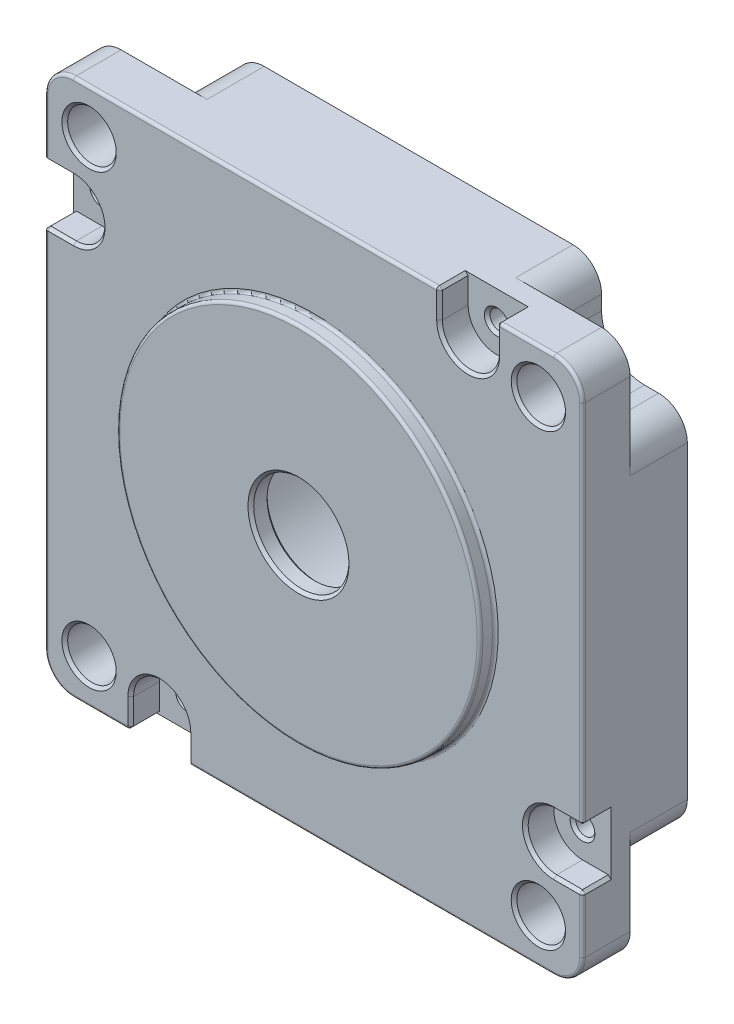
from build123d import *

# Parameters (mm, degrees)
SKETCH1_R           = 5
SKETCH1_R_2         = 2.55
SKETCH1_R_3         = 1
BOSS_EXTRUDE1_DEPTH = 11
SKETCH2_R           = 19.05
SKETCH2_R_2         = 5
BOSS_EXTRUDE2_DEPTH = 1.6
CUT_EXTRUDE1_DEPTH  = 3
FILLET1_R           = 0.3
CHAMFER1_SIZE       = 0.3
CUT_EXTRUDE2_DEPTH  = 6
CHAMFER2_SIZE       = 0.3
CUT_EXTRUDE3_DEPTH  = 8
SKETCH6_R           = 9
SKETCH6_R_2         = 5
CUT_EXTRUDE4_DEPTH  = 2.6
SKETCH7_R           = 11
SKETCH7_R_2         = 9
CUT_EXTRUDE5_DEPTH  = 1.6
BOSS_EXTRUDE3_START = 3
SKETCH8_R           = 17.5
SKETCH8_R_2         = 11
BOSS_EXTRUDE3_DEPTH = 3
BOSS_EXTRUDE4_START = 7
SKETCH9_R           = 17
SKETCH9_R_2         = 11
BOSS_EXTRUDE4_DEPTH = 7
CHAMFER3_SIZE       = 0.3
CHAMFER4_SIZE       = 0.5
CHAMFER5_SIZE       = 1
CHAMFER5_SIZE2      = 1.732050808


with BuildPart() as part:
    # Sketch1 → Boss-Extrude1 (new body)
    with BuildSketch(Plane.XY):
        with BuildLine():
            Line((-25.2, 28.2), (25.2, 28.2))
            ThreePointArc((25.2, 28.2), (27.321320344, 27.321320344), (28.2, 25.2))
            Line((28.2, 25.2), (28.2, -25.2))
            ThreePointArc((28.2, -25.2), (27.321320344, -27.321320344), (25.2, -28.2))
            Line((25.2, -28.2), (-25.2, -28.2))
            ThreePointArc((-25.2, -28.2), (-27.321320344, -27.321320344), (-28.2, -25.2))
            Line((-28.2, -25.2), (-28.2, 25.2))
            ThreePointArc((-28.2, 25.2), (-27.321320344, 27.321320344), (-25.2, 28.2))
        make_face()
        Circle(SKETCH1_R, mode=Mode.SUBTRACT)
        with Locations((-23.57, 23.57)):
            Circle(SKETCH1_R_2, mode=Mode.SUBTRACT)
        with Locations(Location((23.57, 23.57, 0), (0, 0, 180))):
            Circle(SKETCH1_R_2, mode=Mode.SUBTRACT)
        with Locations((23.57, -23.57)):
            Circle(SKETCH1_R_2, mode=Mode.SUBTRACT)
        with Locations(Location((-23.57, -23.57, 0), (0, 0, 180))):
            Circle(SKETCH1_R_2, mode=Mode.SUBTRACT)
        with Locations((16.2, 25.2)):
            Circle(SKETCH1_R_3, mode=Mode.SUBTRACT)
        with Locations((-25.2, 16.2)):
            Circle(SKETCH1_R_3, mode=Mode.SUBTRACT)
        with Locations((-16.2, -25.2)):
            Circle(SKETCH1_R_3, mode=Mode.SUBTRACT)
        with Locations((25.2, -16.2)):
            Circle(SKETCH1_R_3, mode=Mode.SUBTRACT)
    extrude(amount=BOSS_EXTRUDE1_DEPTH)

    # Sketch2 → Boss-Extrude2 (add)
    with BuildSketch(Plane.XY.offset(11)):
        with Locations(Location((0, 0, 0), (0, 0, 180))):
            Circle(SKETCH2_R)
        Circle(SKETCH2_R_2, mode=Mode.SUBTRACT)
    extrude(amount=BOSS_EXTRUDE2_DEPTH)

    # Sketch3 → Cut-Extrude1 (cut)
    with BuildSketch(Plane.XY.offset(11)):
        with BuildLine():
            Line((13.2, 28.2), (19.2, 28.2))
            Line((19.2, 28.2), (19.2, 25.2))
            ThreePointArc((19.2, 25.2), (16.2, 22.2), (13.2, 25.2))
            Line((13.2, 25.2), (13.2, 28.2))
        make_face()
        with BuildLine():
            Line((-28.2, 13.2), (-28.2, 19.2))
            Line((-28.2, 19.2), (-25.2, 19.2))
            ThreePointArc((-25.2, 19.2), (-22.2, 16.2), (-25.2, 13.2))
            Line((-25.2, 13.2), (-28.2, 13.2))
        make_face()
        with BuildLine():
            Line((28.2, -13.2), (28.2, -19.2))
            Line((28.2, -19.2), (25.2, -19.2))
            ThreePointArc((25.2, -19.2), (22.2, -16.2), (25.2, -13.2))
            Line((25.2, -13.2), (28.2, -13.2))
        make_face()
        with BuildLine():
            Line((-13.2, -28.2), (-13.2, -25.2))
            ThreePointArc((-13.2, -25.2), (-16.2, -22.2), (-19.2, -25.2))
            Line((-19.2, -25.2), (-19.2, -28.2))
            Line((-19.2, -28.2), (-13.2, -28.2))
        make_face()
    extrude(amount=-CUT_EXTRUDE1_DEPTH, mode=Mode.SUBTRACT)

    # Fillet1
    fillet1_edges = [part.edges().sort_by_distance(p)[0] for p in [
        (-27.321320344, 27.321320344, 11),
        (6, -28.2, 11),
        (-28.2, 22.2, 11),
        (-27.321320344, -27.321320344, 11),
        (-22.2, -28.2, 11),
        (27.321320344, -27.321320344, 11),
        (28.2, -22.2, 11),
        (27.321320344, 27.321320344, 11),
        (19.05, 0, 11),
        (19.05, 0, 12.6),
        (22.2, 28.2, 11),
        (-6, 28.2, 11),
        (-28.2, -6, 11),
        (28.2, 6, 11),
    ]]
    fillet(fillet1_edges, radius=FILLET1_R)

    # Chamfer1
    chamfer1_edges = [part.edges().sort_by_distance(p)[0] for p in [
        (28.2, -13.2, 9.35),
        (28.2, -19.2, 9.35),
        (24.2, -16.2, 8),
        (22.2, -16.2, 11),
        (26.55, -19.2, 11),
        (-13.2, -28.2, 9.35),
        (-19.2, -28.2, 9.35),
        (-17.2, -25.2, 8),
        (-16.2, -22.2, 11),
        (-19.2, -26.55, 11),
        (-13.2, -26.55, 11),
        (26.55, -13.2, 11),
        (13.2, 26.55, 11),
        (-26.55, 13.2, 11),
        (-28.112132034, 19.2, 10.912132034),
        (19.2, 28.112132034, 10.912132034),
        (28.112132034, -19.2, 10.912132034),
        (-19.2, -28.112132034, 10.912132034),
        (13.2, 28.112132034, 10.912132034),
        (28.112132034, -13.2, 10.912132034),
        (-13.2, -28.112132034, 10.912132034),
        (-28.112132034, 13.2, 10.912132034),
        (19.2, 28.2, 9.35),
        (13.2, 28.2, 9.35),
        (15.2, 25.2, 8),
        (19.2, 26.55, 11),
        (16.2, 22.2, 11),
        (-28.2, 13.2, 9.35),
        (-28.2, 19.2, 9.35),
        (-26.2, 16.2, 8),
        (-22.2, 16.2, 11),
        (-26.55, 19.2, 11),
    ]]
    chamfer(chamfer1_edges, length=CHAMFER1_SIZE - 0.0001)  # a hair under: the kernel refuses the full size

    # Sketch4 → Cut-Extrude2 (cut)
    with BuildSketch(Plane(origin=(0, 0, 0), x_dir=(-1, 0, 0), z_dir=(0, 0, -1))):
        with BuildLine():
            Line((-23.7, 19.2), (-25.185156579, 19.199963279))
            ThreePointArc((-25.185156579, 19.199963279), (-27.316065894, 18.32656181), (-28.2, 16.2))
            Line((-28.2, 16.2), (-28.2, 25.2))
            ThreePointArc((-28.2, 25.2), (-27.321320344, 27.321320344), (-25.2, 28.2))
            Line((-25.2, 28.2), (-16.2, 28.2))
            ThreePointArc((-16.2, 28.2), (-18.321320344, 27.321320344), (-19.2, 25.2))
            Line((-19.2, 25.2), (-19.2, 23.7))
            ThreePointArc((-19.2, 23.7), (-20.518019485, 20.518019485), (-23.7, 19.2))
        make_face()
        with BuildLine():
            Line((19.2, 23.7), (19.2, 25.2))
            ThreePointArc((19.2, 25.2), (18.321320344, 27.321320344), (16.2, 28.2))
            Line((16.2, 28.2), (25.2, 28.2))
            ThreePointArc((25.2, 28.2), (27.321320344, 27.321320344), (28.2, 25.2))
            Line((28.2, 25.2), (28.2, 16.2))
            ThreePointArc((28.2, 16.2), (27.316065894, 18.32656181), (25.185156579, 19.199963279))
            Line((25.185156579, 19.199963279), (23.7, 19.2))
            ThreePointArc((23.7, 19.2), (20.518019485, 20.518019485), (19.2, 23.7))
        make_face()
        with BuildLine():
            Line((-28.2, -16.2), (-28.2, -25.2))
            ThreePointArc((-28.2, -25.2), (-27.321320344, -27.321320344), (-25.2, -28.2))
            Line((-25.2, -28.2), (-16.2, -28.2))
            ThreePointArc((-16.2, -28.2), (-18.321320344, -27.321320344), (-19.2, -25.2))
            Line((-19.2, -25.2), (-19.2, -23.7))
            ThreePointArc((-19.2, -23.7), (-20.518019485, -20.518019485), (-23.7, -19.2))
            Line((-23.7, -19.2), (-25.185156579, -19.199963279))
            ThreePointArc((-25.185156579, -19.199963279), (-27.316065894, -18.32656181), (-28.2, -16.2))
        make_face()
        with BuildLine():
            Line((28.2, -16.2), (28.2, -25.2))
            ThreePointArc((28.2, -25.2), (27.321320344, -27.321320344), (25.2, -28.2))
            Line((25.2, -28.2), (16.2, -28.2))
            ThreePointArc((16.2, -28.2), (18.321320344, -27.321320344), (19.2, -25.2))
            Line((19.2, -25.2), (19.2, -23.7))
            ThreePointArc((19.2, -23.7), (20.518019485, -20.518019485), (23.7, -19.2))
            Line((23.7, -19.2), (25.185156579, -19.199963279))
            ThreePointArc((25.185156579, -19.199963279), (27.316065894, -18.32656181), (28.2, -16.2))
        make_face()
    extrude(amount=-CUT_EXTRUDE2_DEPTH, mode=Mode.SUBTRACT)

    # Chamfer2
    chamfer2_edges = [part.edges().sort_by_distance(p)[0] for p in [
        (-26.12, 23.57, 11),
        (26.12, 23.57, 11),
        (26.12, 23.57, 6),
        (21.02, -23.57, 11),
        (-26.12, 23.57, 6),
        (21.02, -23.57, 6),
        (-21.02, -23.57, 11),
        (-21.02, -23.57, 6),
    ]]
    chamfer(chamfer2_edges, length=CHAMFER2_SIZE)

    # Sketch5 → Cut-Extrude3 (cut)
    with BuildSketch(Plane(origin=(0, 0, 0), x_dir=(-1, 0, 0), z_dir=(0, 0, -1))):
        Polygon((10.810973978, -26.1), (26.1, -10.810973978), (26.1, 10.810973978), (10.810973978, 26.1), (-10.810973978, 26.1), (-26.1, 10.810973978), (-26.1, -10.810973978), (-10.810973978, -26.1), align=None)
    extrude(amount=-CUT_EXTRUDE3_DEPTH, mode=Mode.SUBTRACT)

    # Sketch6 → Cut-Extrude4 (cut)
    with BuildSketch(Plane(origin=(0, 0, 8), x_dir=(-1, 0, 0), z_dir=(0, 0, -1))):
        Circle(SKETCH6_R)
        Circle(SKETCH6_R_2, mode=Mode.SUBTRACT)
    extrude(amount=-CUT_EXTRUDE4_DEPTH, mode=Mode.SUBTRACT)

    # Sketch7 → Cut-Extrude5 (cut)
    with BuildSketch(Plane(origin=(0, 0, 8), x_dir=(-1, 0, 0), z_dir=(0, 0, -1))):
        Circle(SKETCH7_R)
        Circle(SKETCH7_R_2, mode=Mode.SUBTRACT)
    extrude(amount=-CUT_EXTRUDE5_DEPTH, mode=Mode.SUBTRACT)

    # Sketch8 → Boss-Extrude3 (add)
    with BuildSketch(Plane(origin=(0, 0, 8), x_dir=(-1, 0, 0), z_dir=(0, 0, -1)).offset(BOSS_EXTRUDE3_START)):
        Circle(SKETCH8_R)
        Circle(SKETCH8_R_2, mode=Mode.SUBTRACT)
    extrude(amount=-BOSS_EXTRUDE3_DEPTH)

    # Sketch9 → Boss-Extrude4 (add)
    with BuildSketch(Plane(origin=(0, 0, 5), x_dir=(-1, 0, 0), z_dir=(0, 0, -1)).offset(BOSS_EXTRUDE4_START)):
        Circle(SKETCH9_R)
        Circle(SKETCH9_R_2, mode=Mode.SUBTRACT)
    extrude(amount=-BOSS_EXTRUDE4_DEPTH)

    # Chamfer3
    chamfer3_edges = [part.edges().sort_by_distance(p)[0] for p in [
        (15.2, 25.2, 0),
        (-26.2, 16.2, 0),
        (-17.2, -25.2, 0),
        (0, -26.1, 0),
        (-18.455486989, -18.455486989, 0),
        (-26.1, 0, 0),
        (-18.455486989, 18.455486989, 0),
        (0, 26.1, 0),
        (18.455486989, 18.455486989, 0),
        (26.1, 0, 0),
        (18.455486989, -18.455486989, 0),
        (-5, 0, 10.6),
        (24.2, -16.2, 0),
        (-5, 0, 12.6),
    ]]
    chamfer(chamfer3_edges, length=CHAMFER3_SIZE)

    # Chamfer4
    chamfer4_edges = [part.edges().sort_by_distance(p)[0] for p in [
        (17, 0, -2),
    ]]
    chamfer(chamfer4_edges, length=CHAMFER4_SIZE)

    # Chamfer5
    chamfer5_edges = [part.edges().sort_by_distance(p)[0] for p in [
        (11, 0, -2),
    ]]
    chamfer5_side = [part.faces().sort_by_distance(p)[0] for p in [
        (16.033309524, 0, -2),
    ]]
    chamfer(chamfer5_edges, length=CHAMFER5_SIZE, length2=CHAMFER5_SIZE2, reference=chamfer5_side[0])


solid = part.part
